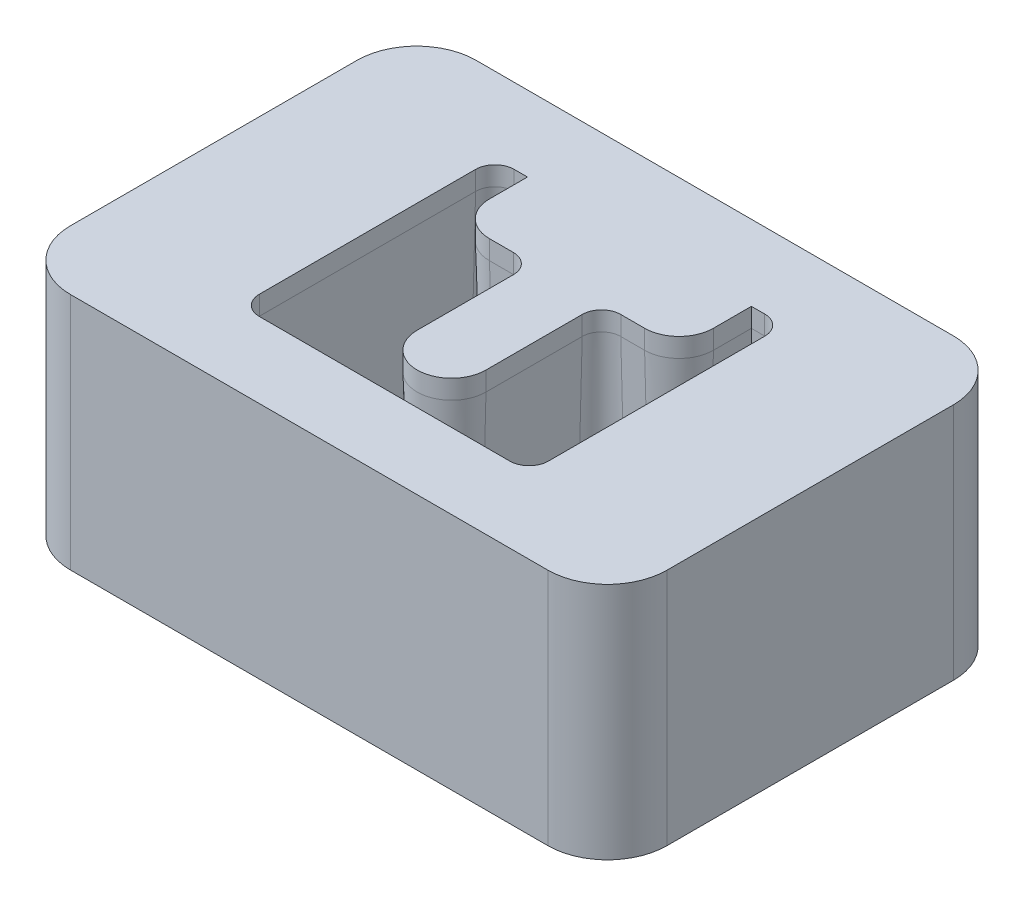
from build123d import *

# Parameters (mm, degrees)
SKETCH1_W                   = 100
SKETCH1_H                   = 68
BOSS_EXTRUDE1_DEPTH         = 40
FILLET1_R                   = 10
CUT_EXTRUDE1_REACH          = 74.498
M6_TAPPED_HOLE1_D           = 5
M6_TAPPED_HOLE1_DEPTH       = 17
M6_TAPPED_HOLE1_CSINK_D     = 6.05
M6_TAPPED_HOLE1_CSINK_ANGLE = 90
M6_TAPPED_HOLE1_TIP         = 1.502151548


with BuildPart() as part:
    # Sketch1 → Boss-Extrude1 (new body)
    with BuildSketch(Plane(origin=(0, 0, 0), x_dir=(1, 0, 0), z_dir=(0, 1, 0))):
        Rectangle(SKETCH1_W, SKETCH1_H)
    extrude(amount=-BOSS_EXTRUDE1_DEPTH)

    # Fillet1
    fillet1_edges = [part.edges().sort_by_distance(p)[0] for p in [
        (-50, -20, -34),
        (50, -20, -34),
        (50, -20, 34),
        (-50, -20, 34),
    ]]
    fillet(fillet1_edges, radius=FILLET1_R)

    # Sketch2 → Cut-Extrude1 (cut, up to next)
    with BuildSketch(Plane(origin=(0, 0, 0), x_dir=(1, 0, 0), z_dir=(0, 1, 0)), mode=Mode.PRIVATE) as cut_extrude1_sk1:
        with BuildLine():
            Line((-21, -21.36), (21, -21.36))
            ThreePointArc((21, -21.36), (23.283954903, -20.413954903), (24.23, -18.13))
            Line((24.23, -18.13), (24.23, 18.13))
            ThreePointArc((24.23, 18.13), (23.283954903, 20.413954903), (21, 21.36))
            Line((21, 21.36), (18.77, 21.36))
            Line((18.77, 21.36), (18.77, 15))
            ThreePointArc((18.77, 15), (17.080006127, 10.919993873), (13, 9.23))
            Line((13, 9.23), (9, 9.23))
            ThreePointArc((9, 9.23), (6.716045097, 8.283954903), (5.77, 6))
            Line((5.77, 6), (5.77, -10.13))
            ThreePointArc((5.77, -10.13), (0, -15.9), (-5.77, -10.13))
            Line((-5.77, -10.13), (-5.77, 6))
            ThreePointArc((-5.77, 6), (-6.716045097, 8.283954903), (-9, 9.23))
            Line((-9, 9.23), (-13, 9.23))
            ThreePointArc((-13, 9.23), (-17.080006127, 10.919993873), (-18.77, 15))
            Line((-18.77, 15), (-18.77, 21.36))
            Line((-18.77, 21.36), (-21, 21.36))
            ThreePointArc((-21, 21.36), (-23.283954903, 20.413954903), (-24.23, 18.13))
            Line((-24.23, 18.13), (-24.23, -18.13))
            ThreePointArc((-24.23, -18.13), (-23.283954903, -20.413954903), (-21, -21.36))
        make_face()
    cut_extrude1_tool1 = extrude(cut_extrude1_sk1.sketch, amount=-CUT_EXTRUDE1_REACH, mode=Mode.PRIVATE) & part.part
    add(cut_extrude1_tool1.solids().sort_by_distance((0, 0, 20.713984))[0], mode=Mode.SUBTRACT)

    # Cut-Sweep1: sweep along a path in Sketch5
    with BuildLine(Plane(origin=(0, 0, 0), x_dir=(1, 0, 0), z_dir=(0, 1, 0))) as cut_sweep1_path:
        Line((-21, -21.36), (21, -21.36))
        ThreePointArc((21, -21.36), (23.283954903, -20.413954903), (24.23, -18.13))
        Line((24.23, -18.13), (24.23, 18.13))
        ThreePointArc((24.23, 18.13), (23.283954903, 20.413954903), (21, 21.36))
        Line((21, 21.36), (18.77, 21.36))
        Line((18.77, 21.36), (18.77, 15))
        ThreePointArc((18.77, 15), (17.080006127, 10.919993873), (13, 9.23))
        Line((13, 9.23), (9, 9.23))
        ThreePointArc((9, 9.23), (6.716045097, 8.283954903), (5.77, 6))
        Line((5.77, 6), (5.77, -10.13))
        ThreePointArc((5.77, -10.13), (0, -15.9), (-5.77, -10.13))
        Line((-5.77, -10.13), (-5.77, 6))
        ThreePointArc((-5.77, 6), (-6.716045097, 8.283954903), (-9, 9.23))
        Line((-9, 9.23), (-13, 9.23))
        ThreePointArc((-13, 9.23), (-17.080006127, 10.919993873), (-18.77, 15))
        Line((-18.77, 15), (-18.77, 21.36))
        Line((-18.77, 21.36), (-21, 21.36))
        ThreePointArc((-21, 21.36), (-23.283954903, 20.413954903), (-24.23, 18.13))
        Line((-24.23, 18.13), (-24.23, -18.13))
        ThreePointArc((-24.23, -18.13), (-23.283954903, -20.413954903), (-21, -21.36))
    # Sketch3 → Cut-Sweep1 (sweep, cut)
    with BuildSketch(Plane.XY):
        Polygon((24.23, -3.2), (25.193641914, -40), (23.23, -40), (23.23, -3.2), align=None)
    sweep(path=cut_sweep1_path.line, transition=Transition.RIGHT, mode=Mode.SUBTRACT)

    # M6 Tapped Hole1
    with Locations(Plane(origin=(0, -40, 0), x_dir=(-1, 0, 0), z_dir=(0, -1, 0))):
        with Locations((-43, 27), (43, 27), (43, -27), (-43, -27)):
            CounterSinkHole(M6_TAPPED_HOLE1_D / 2, M6_TAPPED_HOLE1_CSINK_D / 2, depth=M6_TAPPED_HOLE1_DEPTH, counter_sink_angle=M6_TAPPED_HOLE1_CSINK_ANGLE)
            with Locations((0, 0, -(M6_TAPPED_HOLE1_DEPTH + M6_TAPPED_HOLE1_TIP / 2))):  # 118° drill point
                Cone(0, M6_TAPPED_HOLE1_D / 2, M6_TAPPED_HOLE1_TIP, mode=Mode.SUBTRACT)


solid = part.part
